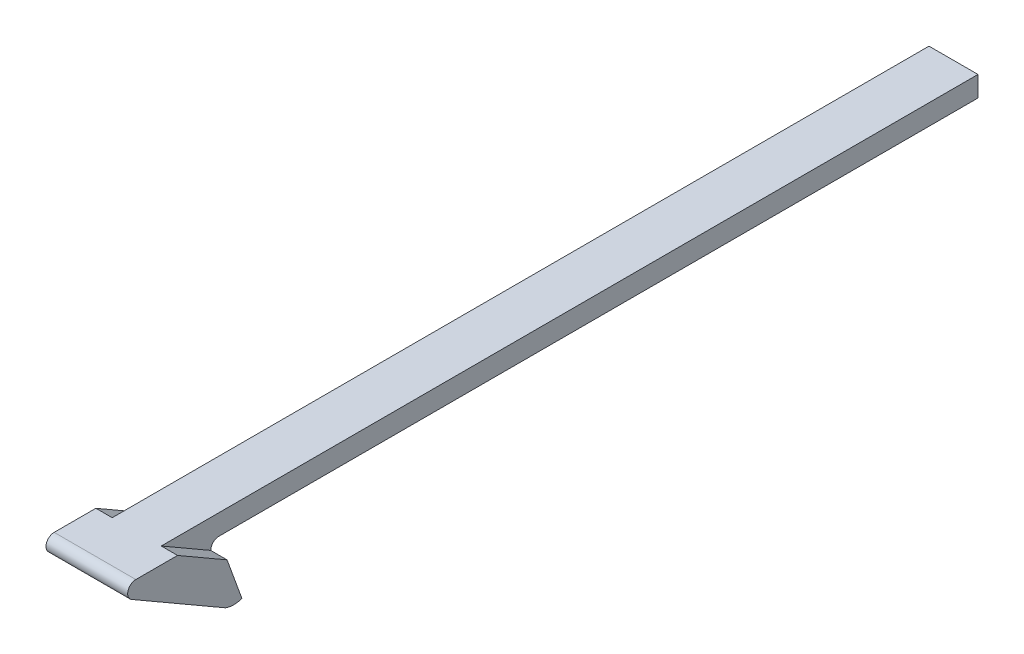
from build123d import *

# Parameters (mm, degrees)
SKETCH1_W           = 100
SKETCH1_H           = 2.5
BOSS_EXTRUDE1_DEPTH = 3
BOSS_EXTRUDE2_DEPTH = 5
FILLET4_R           = 1
FILLET2_R           = 1


with BuildPart() as part:
    # Sketch1 → Boss-Extrude1 (new, symmetric)
    with BuildSketch(Plane(origin=(0, 0, 0), x_dir=(0, 0, -1), z_dir=(1, 0, 0))):
        with Locations((50, -1.25)):
            Rectangle(SKETCH1_W, SKETCH1_H)
    extrude(amount=BOSS_EXTRUDE1_DEPTH, both=True)

    # Sketch2 → Boss-Extrude2 (add, symmetric)
    with BuildSketch(Plane(origin=(0, 0, 0), x_dir=(0, 0, -1), z_dir=(1, 0, 0))):
        with BuildLine():
            Line((0, 0), (-8.840402867, 0))
            Line((-8.840402867, 0), (5.882028998, -8.5))
            ThreePointArc((5.882028998, -8.5), (6.882028998, -8.671572875), (7.882028998, -8.5))
            Line((7.882028998, -8.5), (6.062177826, -3.5))
            Line((6.062177826, -3.5), (0, 0))
        make_face()
    extrude(amount=BOSS_EXTRUDE2_DEPTH, both=True)

    # Fillet4
    # the kernel refuses this fillet: 1 mm, written as the material it adds along each edge
    with BuildSketch(Plane(origin=(-3, -2.5, -4.330127019), x_dir=(0, 0, -1), z_dir=(1, 0, 0))) as fillet4_piece_1:
        with BuildLine():
            CenterArc((2.732050808, -1), FILLET4_R, 90, 90)
            Line((1.732050808, -1), (1.712050808, -1))
            ThreePointArc((1.712050808, -1), (0.856025404, -0.517320508), (-0.01, -0.017320508))
            Line((-0.01, -0.017320508), (0, 0.02))
            Line((0, 0.02), (2.732050808, 0.02))
            Line((2.732050808, 0.02), (2.732050808, 0))
        make_face()
    extrude(amount=6)

    # Fillet2
    fillet2_edges = [part.edges().sort_by_distance(p)[0] for p in [
        (0, 0, 8.840402867),
    ]]
    fillet(fillet2_edges, radius=FILLET2_R)


solid = part.part
